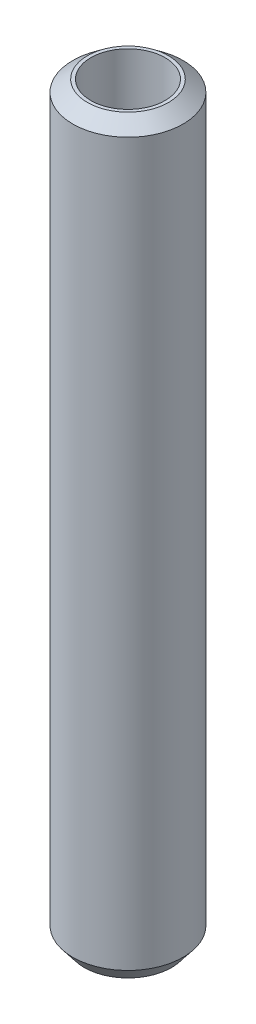
from build123d import *
from OCP.BRepFilletAPI import BRepFilletAPI_MakeChamfer

# Parameters (mm, degrees)
SKETCH1_R           = 27.5
BOSS_EXTRUDE1_DEPTH = 372.887928078
SKETCH2_R           = 18.537569225
CUT_EXTRUDE1_DEPTH  = 375.910531869
CHAMFER1_SIZE       = 5.685151976
CHAMFER1_SIZE2      = 7.280476947


with BuildPart() as part:
    # Sketch1 → Boss-Extrude1 (new body)
    with BuildSketch(Plane(origin=(0, 0, 0), x_dir=(1, 0, 0), z_dir=(0, 1, 0))):
        Circle(SKETCH1_R)
    extrude(amount=BOSS_EXTRUDE1_DEPTH)

    # Sketch2 → Cut-Extrude1 (cut, through all)
    with BuildSketch(Plane(origin=(0, 0, 0), x_dir=(1, 0, 0), z_dir=(0, 1, 0))):
        Circle(SKETCH2_R)
    extrude(amount=CUT_EXTRUDE1_DEPTH, mode=Mode.SUBTRACT)

    # Chamfer1: one chamfer whose edges measure the first distance from different faces: ONE call of the kernel's chamfer builder (chamfer() names one face for all edges)
    chamfer1_edges_1 = [part.edges().sort_by_distance(p)[0] for p in [
        (-27.5, 372.887928078, 0),
    ]]
    chamfer1_side_1 = [part.faces().sort_by_distance(p)[0] for p in [
        (-27.5, 186.443964039, 0),
    ]]
    chamfer1_edges_2 = [part.edges().sort_by_distance(p)[0] for p in [
        (-27.5, 0, 0),
    ]]
    chamfer1_side_2 = [part.faces().sort_by_distance(p)[0] for p in [
        (-26.722182541, 0, 0),
    ]]
    chamfer1 = BRepFilletAPI_MakeChamfer(part.part.solid().wrapped)
    for e in chamfer1_edges_1:
        chamfer1.Add(CHAMFER1_SIZE, CHAMFER1_SIZE2, e.wrapped, chamfer1_side_1[0].wrapped)  # the first distance lies on this face
    for e in chamfer1_edges_2:
        chamfer1.Add(CHAMFER1_SIZE, CHAMFER1_SIZE2, e.wrapped, chamfer1_side_2[0].wrapped)  # the first distance lies on this face
    add(Compound.cast(chamfer1.Shape()), mode=Mode.REPLACE)


solid = part.part
